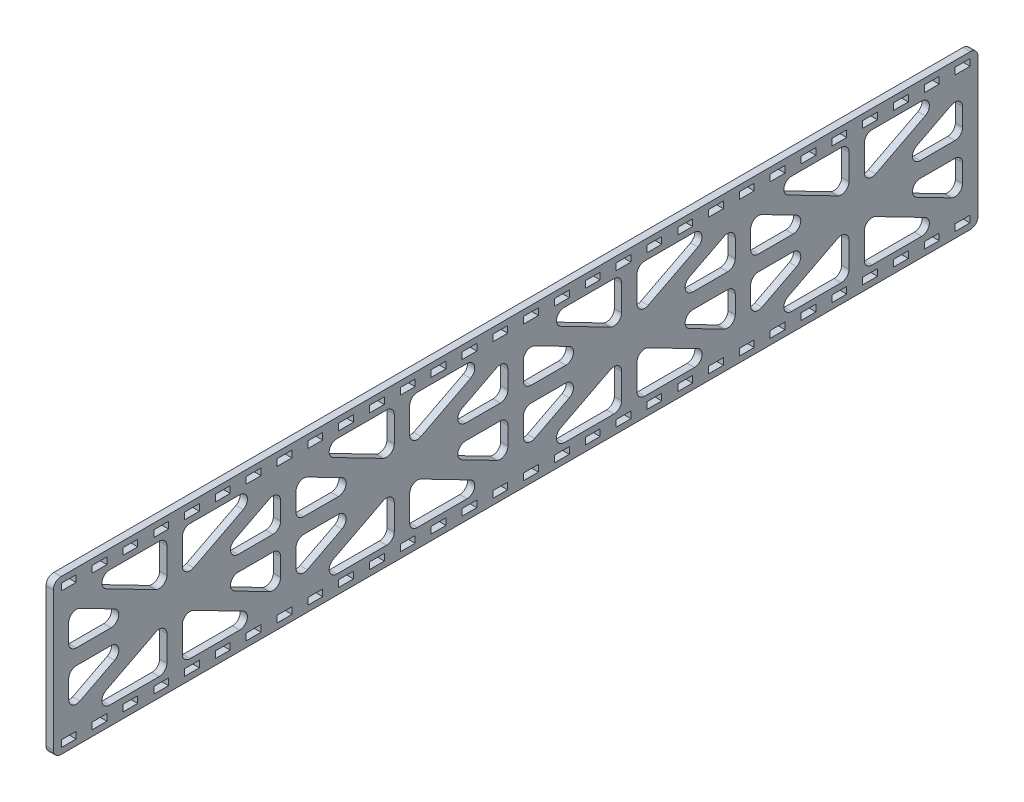
from build123d import *

# Parameters (mm, degrees)
SKETCH1_W          = 381
SKETCH1_H          = 63.5
OUTER_CUT_DEPTH    = 1.4986
CUT_EXTRUDE1_DEPTH = 194.150966106
FILLET1_R          = 3.175
SKETCH2_W          = 6.096
SKETCH2_H          = 2.746000096
SLOT_DEPTH         = 194.150966106
SLOTS_COUNT        = 16
SLOTS_PITCH        = 12.7
SLOTS_COUNT_DIR2   = 16
SLOTS_PITCH_DIR2   = 12.7


# Read off the part's stored shape, not the designer's step: Mirror1
with BuildPart() as part:
    # Sketch1 → Outer Cut (new, symmetric)
    with BuildSketch(Plane(origin=(0, 0, 0), x_dir=(0, 0, -1), z_dir=(1, 0, 0))):
        Rectangle(SKETCH1_W, SKETCH1_H)
    extrude(amount=OUTER_CUT_DEPTH, both=True)

    # Sketch3 → Cut-Extrude1 (cut, through all)
    with BuildSketch(Plane(origin=(1.4986, 0, 0), x_dir=(0, 0, -1), z_dir=(1, 0, 0))):
        Polygon((-184.15, 18.922387635), (-184.15, 3.175), (-153.587635839, 3.175), align=None)
        Polygon((-153.587635839, -3.175), (-184.15, -3.175), (-184.15, -18.922387635), align=None)
        Polygon((-143.66875, -5.207612365), (-180.39312074, -24.13), (-143.66875, -24.13), align=None)
        Polygon((-143.66875, 24.13), (-180.39312074, 24.13), (-143.66875, 5.207612365), align=None)
        Polygon((-100.59437926, 24.13), (-137.31875, 24.13), (-137.31875, 5.207612365), align=None)
        Polygon((-96.8375, 18.922387635), (-127.399864161, 3.175), (-96.8375, 3.175), align=None)
        Polygon((-127.399864161, -3.175), (-96.8375, -18.922387635), (-96.8375, -3.175), align=None)
        Polygon((-137.31875, -5.207612365), (-137.31875, -24.13), (-100.59437926, -24.13), align=None)
        Polygon((-50.00625, -5.207612365), (-86.73062074, -24.13), (-50.00625, -24.13), align=None)
        Polygon((-90.4875, -3.175), (-90.4875, -18.922387635), (-59.925135839, -3.175), align=None)
        Polygon((-90.4875, 18.922387635), (-90.4875, 3.175), (-59.925135839, 3.175), align=None)
        Polygon((-50.00625, 24.13), (-86.73062074, 24.13), (-50.00625, 5.207612365), align=None)
        Polygon((-6.93187926, 24.13), (-43.65625, 24.13), (-43.65625, 5.207612365), align=None)
        Polygon((-3.175, 18.922387635), (-33.737364161, 3.175), (-3.175, 3.175), align=None)
        Polygon((-33.737364161, -3.175), (-3.175, -18.922387635), (-3.175, -3.175), align=None)
        Polygon((-43.65625, -5.207612365), (-43.65625, -24.13), (-6.93187926, -24.13), align=None)
        Polygon((6.93187926, -24.13), (43.65625, -24.13), (43.65625, -5.207612365), align=None)
        Polygon((3.175, -3.175), (3.175, -18.922387635), (33.737364161, -3.175), align=None)
        Polygon((3.175, 18.922387635), (3.175, 3.175), (33.737364161, 3.175), align=None)
        Polygon((43.65625, 5.207612365), (43.65625, 24.13), (6.93187926, 24.13), align=None)
        Polygon((100.59437926, -24.13), (137.31875, -24.13), (137.31875, -5.207612365), align=None)
        Polygon((96.8375, -3.175), (96.8375, -18.922387635), (127.399864161, -3.175), align=None)
        Polygon((96.8375, 3.175), (127.399864161, 3.175), (96.8375, 18.922387635), align=None)
        Polygon((137.31875, 5.207612365), (137.31875, 24.13), (100.59437926, 24.13), align=None)
        Polygon((143.66875, 5.207612365), (180.39312074, 24.13), (143.66875, 24.13), align=None)
        Polygon((153.587635839, 3.175), (184.15, 3.175), (184.15, 18.922387635), align=None)
        Polygon((153.587635839, -3.175), (184.15, -18.922387635), (184.15, -3.175), align=None)
        Polygon((143.66875, -24.13), (180.39312074, -24.13), (143.66875, -5.207612365), align=None)
        Polygon((50.00625, -24.13), (86.73062074, -24.13), (50.00625, -5.207612365), align=None)
        Polygon((59.925135839, -3.175), (90.4875, -18.922387635), (90.4875, -3.175), align=None)
        Polygon((59.925135839, 3.175), (90.4875, 3.175), (90.4875, 18.922387635), align=None)
        Polygon((50.00625, 5.207612365), (86.73062074, 24.13), (50.00625, 24.13), align=None)
    extrude(amount=-CUT_EXTRUDE1_DEPTH, mode=Mode.SUBTRACT)

    # Fillet1
    fillet1_edges = [part.edges().sort_by_distance(p)[0] for p in [
        (0, 5.207612365, 43.65625),
        (0, 24.13, 43.65625),
        (0, 24.13, 6.93187926),
        (0, 24.13, 86.73062074),
        (0, 24.13, 50.00625),
        (0, 5.207612365, 50.00625),
        (0, 3.175, 90.4875),
        (0, 18.922387635, 90.4875),
        (0, 3.175, 59.925135839),
        (0, -18.922387635, 90.4875),
        (0, -3.175, 90.4875),
        (0, -3.175, 59.925135839),
        (0, -5.207612365, -43.65625),
        (0, -24.13, -43.65625),
        (0, -24.13, -6.93187926),
        (0, -5.207612365, 43.65625),
        (0, -24.13, 6.93187926),
        (0, -24.13, 43.65625),
        (0, -3.175, 33.737364161),
        (0, -3.175, 3.175),
        (0, -18.922387635, 3.175),
        (0, 3.175, 33.737364161),
        (0, 18.922387635, 3.175),
        (0, 3.175, 3.175),
        (0, -24.13, 180.39312074),
        (0, -5.207612365, 143.66875),
        (0, -24.13, 143.66875),
        (0, -18.922387635, 184.15),
        (0, -3.175, 184.15),
        (0, -3.175, 153.587635839),
        (0, 24.13, 180.39312074),
        (0, 24.13, 143.66875),
        (0, 5.207612365, 143.66875),
        (0, 5.207612365, 137.31875),
        (0, 24.13, 137.31875),
        (0, 24.13, 100.59437926),
        (0, -5.207612365, 50.00625),
        (0, -24.13, 50.00625),
        (0, -24.13, 86.73062074),
        (0, -5.207612365, 137.31875),
        (0, -24.13, 100.59437926),
        (0, -24.13, 137.31875),
        (0, -18.922387635, 96.8375),
        (0, -3.175, 127.399864161),
        (0, -3.175, 96.8375),
        (0, 3.175, 96.8375),
        (0, 3.175, 127.399864161),
        (0, 18.922387635, 96.8375),
        (0, -5.207612365, -50.00625),
        (0, -24.13, -86.73062074),
        (0, -24.13, -50.00625),
        (0, -5.207612365, -143.66875),
        (0, -24.13, -180.39312074),
        (0, -24.13, -143.66875),
        (0, -3.175, -153.587635839),
        (0, -3.175, -184.15),
        (0, -18.922387635, -184.15),
        (0, 3.175, -153.587635839),
        (0, 18.922387635, -184.15),
        (0, 3.175, -184.15),
        (0, 5.207612365, -50.00625),
        (0, 24.13, -50.00625),
        (0, 24.13, -86.73062074),
        (0, 3.175, -59.925135839),
        (0, 18.922387635, -90.4875),
        (0, 3.175, -90.4875),
        (0, -3.175, -59.925135839),
        (0, -3.175, -90.4875),
        (0, -18.922387635, -90.4875),
        (0, -5.207612365, -137.31875),
        (0, -24.13, -137.31875),
        (0, -24.13, -100.59437926),
        (0, 24.13, -6.93187926),
        (0, 24.13, -43.65625),
        (0, 5.207612365, -43.65625),
        (0, 18.922387635, -3.175),
        (0, 3.175, -33.737364161),
        (0, 3.175, -3.175),
        (0, -18.922387635, -3.175),
        (0, -3.175, -3.175),
        (0, -3.175, -33.737364161),
        (0, 24.13, -143.66875),
        (0, 24.13, -180.39312074),
        (0, 5.207612365, -143.66875),
        (0, 24.13, -100.59437926),
        (0, 24.13, -137.31875),
        (0, 5.207612365, -137.31875),
        (0, 18.922387635, -96.8375),
        (0, 3.175, -127.399864161),
        (0, 3.175, -96.8375),
        (0, -18.922387635, -96.8375),
        (0, -3.175, -96.8375),
        (0, -3.175, -127.399864161),
        (0, 3.175, 184.15),
        (0, 18.922387635, 184.15),
        (0, 3.175, 153.587635839),
        (0, 31.75, 190.5),
        (0, 31.75, -190.5),
        (0, -31.75, -190.5),
        (0, -31.75, 190.5),
    ]]
    fillet(fillet1_edges, radius=FILLET1_R)

    # Sketch2 → Slot (cut, through all)
    with BuildSketch(Plane(origin=(1.4986, 0, 0), x_dir=(0, 0, -1), z_dir=(1, 0, 0))):
        with Locations((6.35, 27.94)):
            Rectangle(SKETCH2_W, SKETCH2_H)
    slot = extrude(amount=-SLOT_DEPTH, mode=Mode.SUBTRACT)

    # Slots: Slot 16 × 16
    with Locations(*[Vector(0, 0, 1) * (i * SLOTS_PITCH) + Vector(0, 0, -1) * (j * SLOTS_PITCH_DIR2) for i in range(SLOTS_COUNT) for j in range(SLOTS_COUNT_DIR2) if (i, j) != (0, 0)]):
        add(slot, mode=Mode.SUBTRACT)

    # Mirror1
    split(bisect_by=Plane.ZX, keep=Keep.TOP)

    # Mirror1 2: part across plane


with BuildPart() as part_1:
    add(part.part)
    add(part.part.mirror(Plane.ZX))


solid = part_1.part
